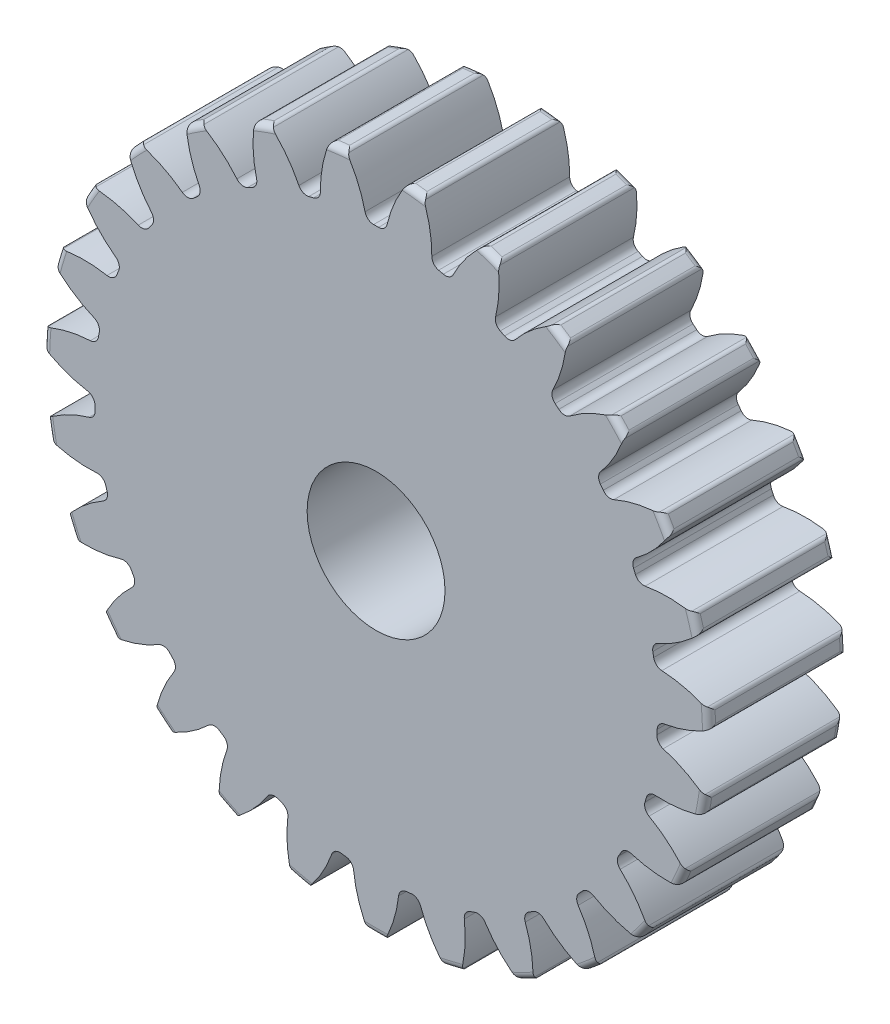
from build123d import *

# Parameters (mm, degrees)
FILLET2_R                = 0.29
CUT_EXTRUDE2_DEPTH       = 23.011360703
FILLET3_R                = 0.380000002
FILLET4_START            = -1
FILLET4_DEPTH            = 8
CIRPATTERN1_COUNT        = 27
FILLET3_OF_CIRPATTERN1_R = 0.380000002
CUT_EXTRUDE3_REACH       = 34.494
CUT_EXTRUDE3_END_RADIUS  = 3
SKETCH8_R                = 2
CHAMFER1_SIZE            = 0.2
SKETCH9_R                = 11.29
CUT_EXTRUDE4_DEPTH       = 8


with BuildPart() as part:
    # Sketch4 → Revolve1 (revolve)
    with BuildSketch(Plane(origin=(0, 0, 0), x_dir=(0, 0, -1), z_dir=(1, 0, 0))):
        Polygon((-14, 3), (-14, 11), (-6, 11), (-6, 14.5), (0, 14.5), (0, 3), align=None)
    revolve(axis=Axis((0, 0, 6), (0, 0, 1)))

    # Fillet2
    fillet2_edges = [part.edges().sort_by_distance(p)[0] for p in [
        (0, -14.5, 0),
        (0, -14.5, 6),
        (0, -11, 6),
        (0, -11, 14),
    ]]
    fillet(fillet2_edges, radius=FILLET2_R)

    # Sketch7 → Cut-Extrude2 (cut, through all)
    with BuildSketch(Plane.XY.offset(6)):
        with BuildLine():
            ThreePointArc((-1.322639733, 14.43955069), (0, 14.5), (1.322639733, 14.43955069))
            ThreePointArc((1.322639733, 14.43955069), (0.74885259, 13.391444196), (0.419609262, 12.242811209))
            ThreePointArc((0.419609262, 12.242811209), (0, 12.249999928), (-0.419609262, 12.242811209))
            ThreePointArc((-0.419609262, 12.242811209), (-0.74885259, 13.391444196), (-1.322639733, 14.43955069))
        make_face()
    cut_extrude2 = extrude(amount=-CUT_EXTRUDE2_DEPTH, mode=Mode.SUBTRACT)

    # Fillet3
    fillet3_edges = [part.edges().sort_by_distance(p)[0] for p in [
        (-0.419609262, 12.242811209, 3),
        (0.419609262, 12.242811209, 3),
    ]]
    fillet(fillet3_edges, radius=FILLET3_R)

    # Fillet4: read off the stored shape, not the designer's step
    # Fillet4 outline → Fillet4 (cut)
    with BuildSketch(Plane.XY.offset(FILLET4_START)):
        with BuildLine():
            ThreePointArc((-1.322639733, 14.43955069), (-1.378728885, 14.434303123), (-1.434797226, 14.428837684))
            ThreePointArc((-1.434797226, 14.428837684), (-1.334978919, 14.411631036), (-1.258186111, 14.345580845))
            ThreePointArc((-1.258186111, 14.345580845), (-1.29016672, 14.392738223), (-1.322639733, 14.43955069))
        make_face()
        with BuildLine():
            ThreePointArc((1.258186111, 14.345580845), (1.334978919, 14.411631036), (1.434797226, 14.428837684))
            ThreePointArc((1.434797226, 14.428837684), (1.378728885, 14.434303123), (1.322639733, 14.43955069))
            ThreePointArc((1.322639733, 14.43955069), (1.29016672, 14.392738223), (1.258186111, 14.345580845))
        make_face()
    fillet4 = extrude(amount=FILLET4_DEPTH, mode=Mode.SUBTRACT)

    # CirPattern1: Cut-Extrude2, Fillet4 ×27 about axis
    cirpattern1_axis = Axis((0, 0, 0), (0, 0, 1))
    add([cut_extrude2.rotate(cirpattern1_axis, i * 360 / CIRPATTERN1_COUNT) for i in range(1, CIRPATTERN1_COUNT)], mode=Mode.SUBTRACT)
    add([fillet4.rotate(cirpattern1_axis, i * 360 / CIRPATTERN1_COUNT) for i in range(1, CIRPATTERN1_COUNT)], mode=Mode.SUBTRACT)

    # Fillet3 of CirPattern1
    fillet3_of_cirpattern1_edges = [part.edges().sort_by_distance(p)[0] for p in [
        (-3.231685207, 11.816036093, 3),
        (-2.415087927, 12.009573204, 3),
        (-5.869540167, 10.752255413, 3),
        (-5.119587101, 11.128895999, 3),
        (-8.190966696, 9.10881786, 3),
        (-7.54808801, 9.648257129, 3),
        (-10.070816091, 6.974321579, 3),
        (-9.569669539, 7.647478221, 3),
        (-11.407745184, 4.463837816, 3),
        (-11.075347707, 5.234421782, 3),
        (-12.129679781, 1.712707402, 3),
        (-11.983951014, 2.53917631, 3),
        (-12.197700202, -1.130755513, 3),
        (-12.246496419, -0.292956814, 3),
        (-11.608139447, -3.913259104, 3),
        (-11.848830032, -3.10929656, 3),
        (-10.39278089, -6.484797885, 3),
        (-10.812390152, -5.758013324, 3),
        (-8.617144825, -8.706739533, 3),
        (-9.193051519, -8.096314099, 3),
        (-6.376956252, -10.459298599, 3),
        (-7.0781131, -9.998140486, 3),
        (-3.792984317, -11.647994171, 3),
        (-4.581591772, -11.360964531, 3),
        (-1.004531616, -12.208743362, 3),
        (-1.838075645, -12.111316038, 3),
        (1.838075645, -12.111316038, 3),
        (1.004531616, -12.208743362, 3),
        (4.581591772, -11.360964531, 3),
        (3.792984317, -11.647994171, 3),
        (7.0781131, -9.998140486, 3),
        (6.376956252, -10.459298599, 3),
        (9.193051519, -8.096314099, 3),
        (8.617144825, -8.706739533, 3),
        (10.812390152, -5.758013324, 3),
        (10.39278089, -6.484797885, 3),
        (11.848830032, -3.10929656, 3),
        (11.608139447, -3.913259104, 3),
        (12.246496419, -0.292956814, 3),
        (12.197700202, -1.130755513, 3),
        (11.983951014, 2.53917631, 3),
        (12.129679781, 1.712707402, 3),
        (11.075347707, 5.234421782, 3),
        (11.407745184, 4.463837816, 3),
        (9.569669539, 7.647478221, 3),
        (10.070816091, 6.974321579, 3),
        (7.54808801, 9.648257129, 3),
        (8.190966696, 9.10881786, 3),
        (5.119587101, 11.128895999, 3),
        (5.869540167, 10.752255413, 3),
        (2.415087927, 12.009573204, 3),
        (3.231685207, 11.816036093, 3),
    ]]
    fillet(fillet3_of_cirpattern1_edges, radius=FILLET3_OF_CIRPATTERN1_R)

    # Cut-Extrude3: up to this cylinder (the profile starts outside it)
    cut_extrude3_end = Plane(origin=(0, 0, 10), z_dir=(0, 0, -1)) * Cylinder(CUT_EXTRUDE3_END_RADIUS, 75.988, mode=Mode.PRIVATE)
    # Sketch8 → Cut-Extrude3 (cut, up to the surface)
    with BuildSketch(Plane(origin=(11, 0, 0), x_dir=(0, 0, -1), z_dir=(1, 0, 0)), mode=Mode.PRIVATE) as cut_extrude3_sk1:
        with Locations((-10, 0)):
            Circle(SKETCH8_R)
    cut_extrude3_tool1 = extrude(cut_extrude3_sk1.sketch, amount=-CUT_EXTRUDE3_REACH, mode=Mode.PRIVATE) - cut_extrude3_end
    add(cut_extrude3_tool1.solids().sort_by_distance((11, 0, 10))[0], mode=Mode.SUBTRACT)

    # Chamfer1
    chamfer1_edges = [part.edges().sort_by_distance(p)[0] for p in [
        (0, -3, 0),
        (0, -3, 14),
    ]]
    chamfer(chamfer1_edges, length=CHAMFER1_SIZE)

    # Sketch9 → Cut-Extrude4 (cut)
    with BuildSketch(Plane.XY.offset(14)):
        Circle(SKETCH9_R)
    extrude(amount=-CUT_EXTRUDE4_DEPTH, mode=Mode.SUBTRACT)


solid = part.part
